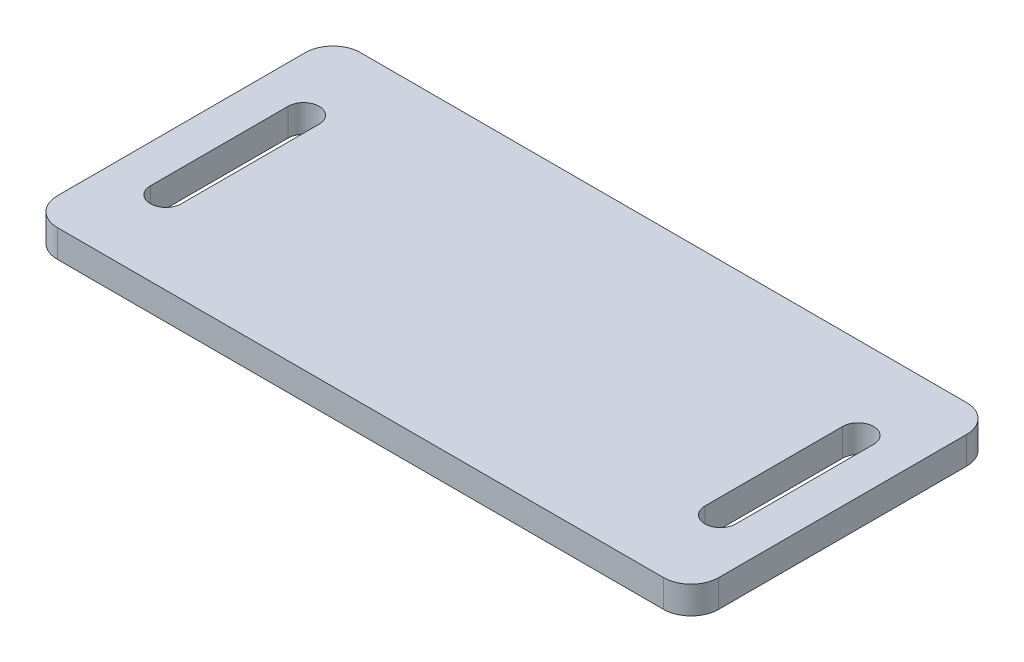
from build123d import *

# Parameters (mm, degrees)
BOSS_EXTRUDE1_DEPTH = 2


with BuildPart() as part:
    # Sketch1 → Boss-Extrude1 (new, symmetric)
    with BuildSketch(Plane(origin=(0, 0, 0), x_dir=(1, 0, 0), z_dir=(0, 1, 0))):
        with BuildLine():
            Line((-44, -22), (44, -22))
            ThreePointArc((44, -22), (46.828427125, -20.828427125), (48, -18))
            Line((48, -18), (48, 18))
            ThreePointArc((48, 18), (46.828427125, 20.828427125), (44, 22))
            Line((44, 22), (-44, 22))
            ThreePointArc((-44, 22), (-46.828427125, 20.828427125), (-48, 18))
            Line((-48, 18), (-48, -18))
            ThreePointArc((-48, -18), (-46.828427125, -20.828427125), (-44, -22))
        make_face()
        with BuildLine():
            Line((-38, 10), (-38, -10))
            ThreePointArc((-38, -10), (-40.25, -12.25), (-42.5, -10))
            Line((-42.5, -10), (-42.5, 10))
            ThreePointArc((-42.5, 10), (-40.25, 12.25), (-38, 10))
        make_face(mode=Mode.SUBTRACT)
        with BuildLine():
            Line((42.5, 10), (42.5, -10))
            ThreePointArc((42.5, -10), (40.25, -12.25), (38, -10))
            Line((38, -10), (38, 10))
            ThreePointArc((38, 10), (40.25, 12.25), (42.5, 10))
        make_face(mode=Mode.SUBTRACT)
    extrude(amount=BOSS_EXTRUDE1_DEPTH, both=True)


solid = part.part
